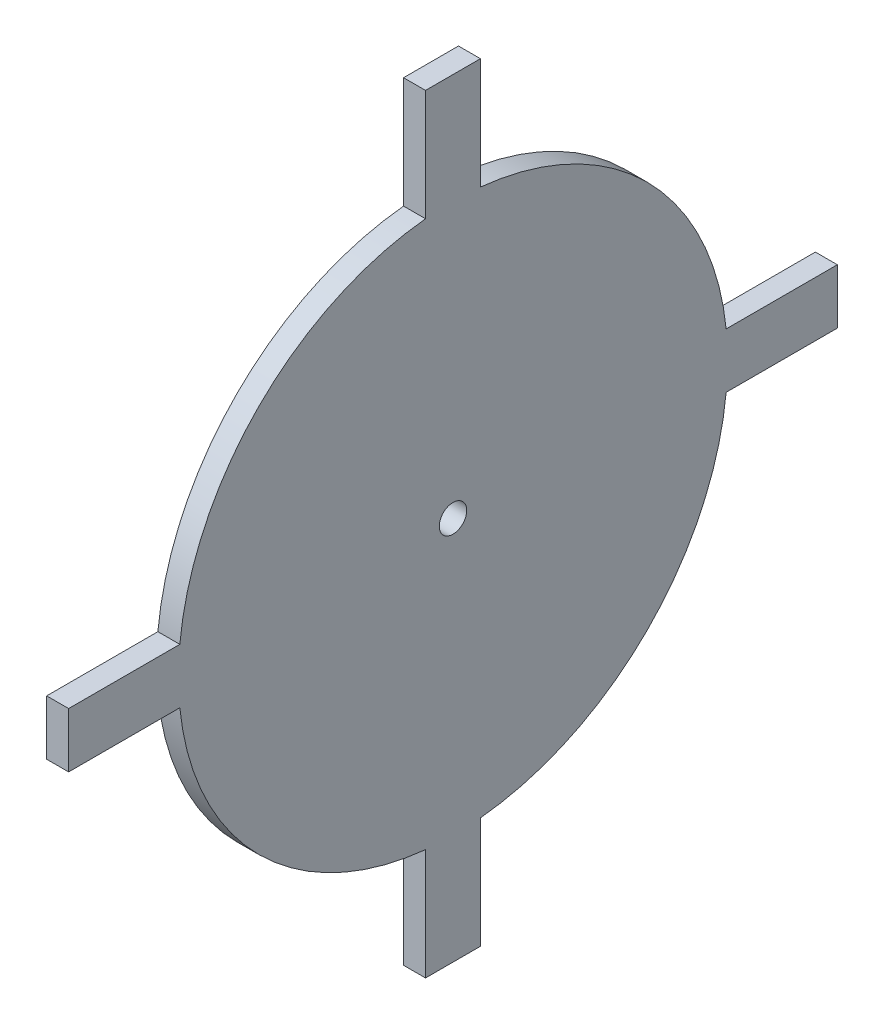
from build123d import *

# Parameters (mm, degrees)
SKETCH1_R           = 3.175
BOSS_EXTRUDE1_DEPTH = 5.08


with BuildPart() as part:
    # Sketch1 → Boss-Extrude1 (new body)
    with BuildSketch(Plane(origin=(0, 0, 0), x_dir=(0, 0, -1), z_dir=(1, 0, 0))):
        with BuildLine():
            Line((6.35, 88.9), (-6.35, 88.9))
            Line((-6.35, 88.9), (-6.35, 63.181702256))
            ThreePointArc((-6.35, 63.181702256), (-44.901280605, 44.901280605), (-63.181702256, 6.35))
            Line((-63.181702256, 6.35), (-88.9, 6.35))
            Line((-88.9, 6.35), (-88.9, -6.35))
            Line((-88.9, -6.35), (-63.181702256, -6.35))
            ThreePointArc((-63.181702256, -6.35), (-44.901280605, -44.901280605), (-6.35, -63.181702256))
            Line((-6.35, -63.181702256), (-6.35, -88.9))
            Line((-6.35, -88.9), (6.35, -88.9))
            Line((6.35, -88.9), (6.35, -63.181702256))
            ThreePointArc((6.35, -63.181702256), (44.901280605, -44.901280605), (63.181702256, -6.35))
            Line((63.181702256, -6.35), (88.9, -6.35))
            Line((88.9, -6.35), (88.9, 6.35))
            Line((88.9, 6.35), (63.181702256, 6.35))
            ThreePointArc((63.181702256, 6.35), (44.901280605, 44.901280605), (6.35, 63.181702256))
            Line((6.35, 63.181702256), (6.35, 88.9))
        make_face()
        Circle(SKETCH1_R, mode=Mode.SUBTRACT)
    extrude(amount=BOSS_EXTRUDE1_DEPTH)


solid = part.part
